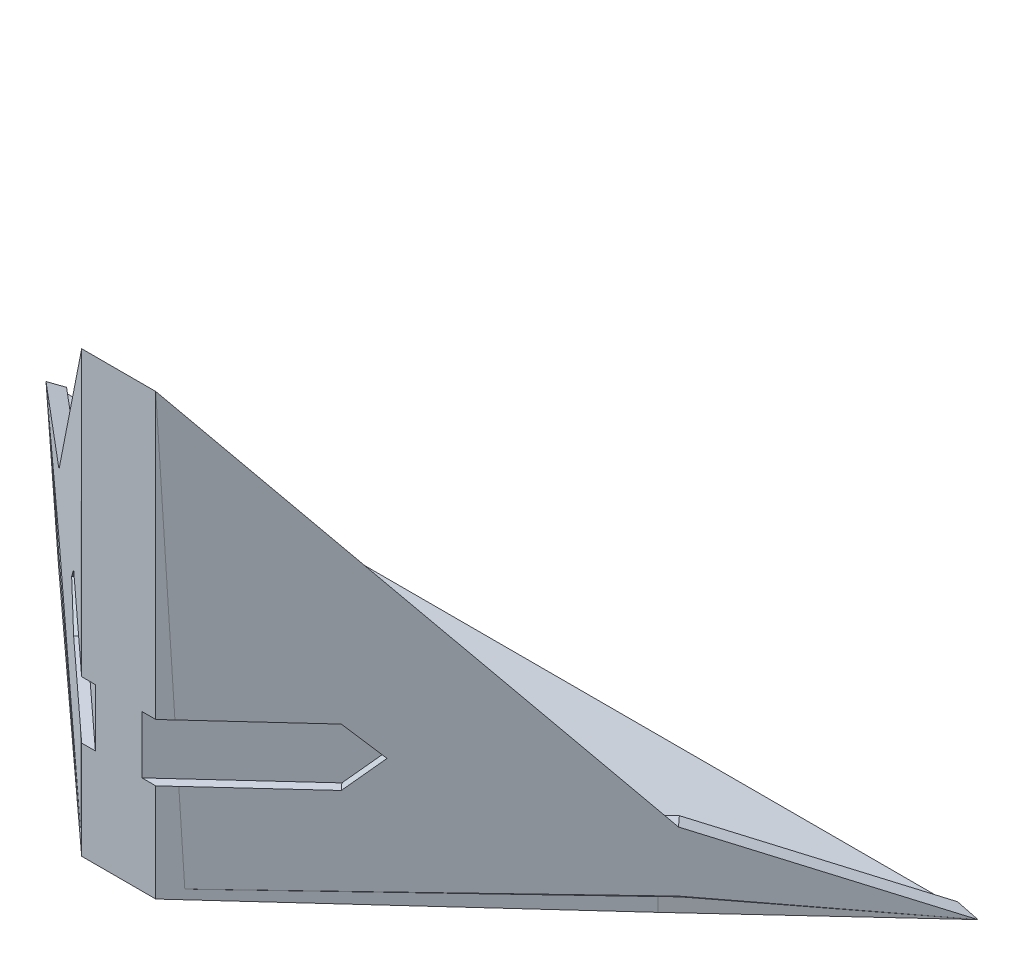
from build123d import *

# Parameters (mm, degrees)
BOSS_EXTRUDE3_START      = -5
BOSS_EXTRUDE3_DEPTH      = 95
CUT_EXTRUDE1_DEPTH       = 211.669436796
CUT_EXTRUDE1_DEPTH_BACK  = 211.669436796
BOSS_EXTRUDE10_DEPTH     = 95
CUT_EXTRUDE2_DEPTH       = 211.669436796
CUT_EXTRUDE2_DEPTH_BACK  = 211.669436796
CUT_EXTRUDE7_DEPTH       = 211.669436796
CUT_EXTRUDE7_DEPTH_BACK  = 211.669436796
CUT_EXTRUDE12_START      = -3
CUT_EXTRUDE12_DEPTH      = 3
CUT_EXTRUDE18_DEPTH      = 263.682253196
CUT_EXTRUDE18_DEPTH_BACK = 263.682253196
CUT_EXTRUDE23_START      = -2
SKETCH26_W               = 5.160164367
SKETCH26_H               = 12.42
CUT_EXTRUDE23_DEPTH      = 207.011897718


# Read off the part's stored shape, not the designer's step: Cut-Extrude12
with BuildPart() as part:
    # Sketch4 → Boss-Extrude3 (new body)
    with BuildSketch(Plane(origin=(0, 0, 0), x_dir=(1, 0, 0), z_dir=(0, 1, 0)).offset(BOSS_EXTRUDE3_START)):
        Polygon((0, 54.04), (-30.96, 85), (170.46, 85), (139.5, 54.04), (139.5, 0), (0, 0), align=None)
    extrude(amount=BOSS_EXTRUDE3_DEPTH)

    # Sketch5 → Cut-Extrude1 (cut, two sides: drawn at the far end of the back side and taken through both)
    with BuildSketch(Plane(origin=(139.5, 0, 0), x_dir=(0, 0, -1), z_dir=(1, 0, 0)).offset(-CUT_EXTRUDE1_DEPTH_BACK)):
        Polygon((0, 90), (3, -3), (54.04, -2), (85, -5), (85, 90), align=None)
    extrude(amount=CUT_EXTRUDE1_DEPTH + CUT_EXTRUDE1_DEPTH_BACK, mode=Mode.SUBTRACT)

    # Sketch12 → Boss-Extrude10 (add)
    with BuildSketch(Plane.XZ.offset(5)):
        Polygon((77.75, 0), (61.75, 0), (5.136208879, -51.905643893), (1.313057643, -55.410852123), (-30.96, -85), (-26.520771025, -85), (62.809775082, -3.09840989), (69.75, -3), (76.690224918, -3.09840989), (166.020771025, -85), (170.46, -85), (138.186942357, -55.410852123), (134.363791121, -51.905643893), align=None)
    extrude(amount=-BOSS_EXTRUDE10_DEPTH)

    # Sketch6 → Cut-Extrude2 (cut, two sides: drawn at the far end of the back side and taken through both)
    with BuildSketch(Plane(origin=(139.5, 0, 0), x_dir=(0, 0, -1), z_dir=(1, 0, 0)).offset(-CUT_EXTRUDE2_DEPTH_BACK)):
        Polygon((54.04, 90), (0, 90), (54.04, 10.932684034), align=None)
    extrude(amount=CUT_EXTRUDE2_DEPTH + CUT_EXTRUDE2_DEPTH_BACK, mode=Mode.SUBTRACT)

    # Sketch18 → Cut-Extrude7 (cut, two sides: drawn at the far end of the back side and taken through both)
    with BuildSketch(Plane(origin=(0, 0, 0), x_dir=(1, 0, 0), z_dir=(0, 1, 0)).offset(-CUT_EXTRUDE7_DEPTH_BACK)):
        Polygon((-30.96, 85), (-32.039877687, 0), (5, 0), (5, 51.757080067), align=None)
        Polygon((61.75, 0), (5, 0), (5, 51.757080067), align=None)
        Polygon((134.5, 0), (77.75, 0), (134.5, 51.757080067), align=None)
        Polygon((170.46, 0), (134.5, 0), (134.5, 51.757080067), (170.46, 85), align=None)
    extrude(amount=CUT_EXTRUDE7_DEPTH + CUT_EXTRUDE7_DEPTH_BACK, mode=Mode.SUBTRACT)

    # Cut-Extrude12 outline → Cut-Extrude12 (cut)
    with BuildSketch(Plane(origin=(37.313647502, 0, 37.073562316), x_dir=(0.7370914330343759, 0, -0.6757930299635608), z_dir=(0.6757930299635608, 0, 0.7370914330343759)).offset(CUT_EXTRUDE12_START)):
        Polygon((134.824655296, 90), (134.824655296, 10.932684034), (180.637498322, -5), (180.637498322, 90), align=None)
    cut_extrude12 = extrude(amount=CUT_EXTRUDE12_DEPTH, mode=Mode.SUBTRACT)

    # Sketch24 → Cut-Extrude18 (cut, two sides: drawn at the far end of the back side and taken through both)
    with BuildSketch(Plane(origin=(-45.105018851, -43.594474596, -16.544137217), x_dir=(-6.841846231332114e-05, 0.3790169981348638, -0.9253897073361853), z_dir=(0.999999997266826, 0, -7.393475590237281e-05)).offset(-CUT_EXTRUDE18_DEPTH_BACK)):
        Polygon((55.352567213, 36.252396593), (85.320423961, 109.420477175), (87.366853148, 108.582309818), (57.398996399, 35.414229236), align=None)
    extrude(amount=CUT_EXTRUDE18_DEPTH + CUT_EXTRUDE18_DEPTH_BACK, mode=Mode.SUBTRACT)

    # Mirror4: Cut-Extrude12 across plane
    add(cut_extrude12.mirror(Plane(origin=(69.75, 0, 0), x_dir=(0, 0, 1), z_dir=(1, 0, 0))), mode=Mode.SUBTRACT)

    # Sketch26 → Cut-Extrude23 (cut)
    with BuildSketch(Plane(origin=(35.508131054, 0, 38.728927412), x_dir=(0.7370914330343759, 0, -0.6757930299635608), z_dir=(0.6757930299635608, 0, 0.7370914330343759)).offset(CUT_EXTRUDE23_START)):
        Polygon((67.688858918, 28.61), (85.688858918, 28.61), (92.688858918, 22.4), (85.688858918, 16.19), (67.688858918, 16.19), align=None)
        with Locations((54.728776735, 22.4)):
            Rectangle(SKETCH26_W, SKETCH26_H)
        Polygon((67.688858918, 16.19), (67.688858918, 28.61), (60.239227379, 28.61), (60.832079248, 16.19), align=None)
        Polygon((60.832079248, 16.19), (60.239227379, 28.61), (57.308858918, 28.61), (57.308858918, 16.19), align=None)
    cut_extrude23 = extrude(amount=CUT_EXTRUDE23_DEPTH, mode=Mode.SUBTRACT)

    # Mirror5: Cut-Extrude23 across plane
    add(cut_extrude23.mirror(Plane(origin=(69.75, 0, 0), x_dir=(0, 0, 1), z_dir=(1, 0, 0))), mode=Mode.SUBTRACT)


solid = part.part
